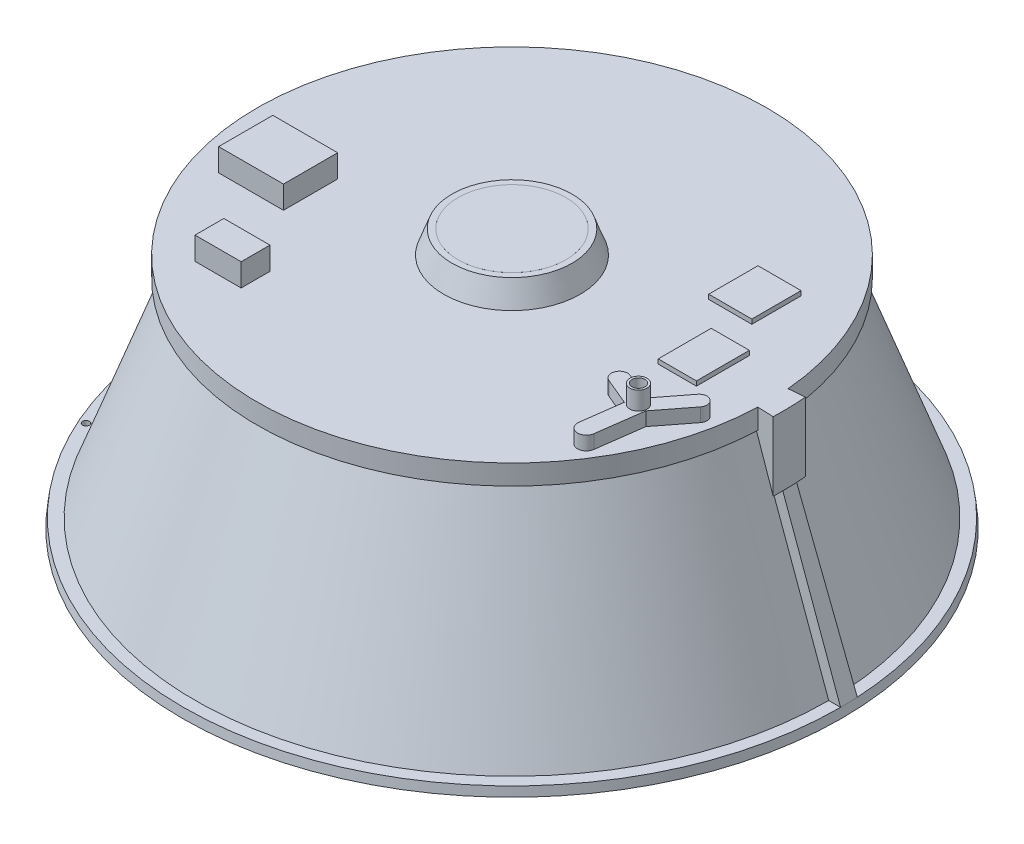
from build123d import *

# Parameters (mm, degrees)
REVOLVE_4_ANGLE           = 5
REVOLVE_4_OTHER_WAY_ANGLE = 2
CUT_EXTRUDE_1_DEPTH       = 1141.120605351
SKETCH_5_R                = 150
EXTRUDE_3_DEPTH           = 50
EXTRUDE_3_TAPER           = 20
SKETCH_9_W                = 101.343282943
SKETCH_9_H                = 63.282990441
SKETCH_9_W_2              = 142.463314855
SKETCH_9_H_2              = 119.061357177
EXTRUDE_5_DEPTH           = 50
SKETCH_9_3_W              = 101.343282943
SKETCH_9_3_H              = 63.282990441
SKETCH_9_3_W_2            = 142.463314855
SKETCH_9_3_H_2            = 119.061357177
SKETCH_9_3_W_3            = 94.707897755
SKETCH_9_3_H_3            = 108.237597434
SKETCH_9_3_W_4            = 83.884138011
SKETCH_9_3_H_4            = 116.355417242
EXTRUDE_6_DEPTH           = 10
EXTRUDE_10_DEPTH          = 30
SKETCH_11_R               = 18.870411167
EXTRUDE_11_DEPTH          = 40
CUT_EXTRUDE_2_DEPTH       = 40
CUT_EXTRUDE_2_DEPTH_BACK  = 1163.91658981
SKETCH_11_3_R             = 14.174126535


with BuildPart() as part:
    # 草图2 → 旋转2 (revolve)
    with BuildSketch(Plane.XY, mode=Mode.PRIVATE) as revolve_2_sk:
        Polygon((0, 520), (514.004150764, 520), (703.268672583, 0), (681.985117133, 0), (500, 500), (0, 500), align=None)
        Polygon((722.028861107, 20), (695.989267897, 20), (703.268672583, 0), (704.38769136, 0), (704.36800355, 0.156467804), (724.525705115, 0.156467804), align=None)
        with BuildLine():
            Line((560.03375626, 520), (514.004150764, 520))
            Line((514.004150764, 520), (522.853935072, 495.685417448))
            ThreePointArc((522.853935072, 495.685417448), (533.278359551, 508.108762772), (547.323148659, 500))
            Line((547.323148659, 500), (560.03375626, 520))
        make_face()
        Polygon((560.03375626, 475.959020857), (560.03375626, 520), (547.323148659, 500), (556.07334947, 475.959020857), align=None)
        with BuildLine():
            ThreePointArc((547.323148659, 500), (533.278359551, 508.108762772), (522.853935072, 495.685417448))
            Line((522.853935072, 495.685417448), (530.03375626, 475.959020857))
            Line((530.03375626, 475.959020857), (556.07334947, 475.959020857))
            Line((556.07334947, 475.959020857), (547.323148659, 500))
        make_face()
    revolve(revolve_2_sk.sketch.rotate(Axis((0, 0, 0), (0, 1, 0)), 90), axis=Axis((0, 0, 0), (0, 1, 0)))

    # 旋转3: read off the stored shape, not the designer's step
    # 旋转3: loft between two sections, ruled curve by curve
    revolve_3_from = [
        Edge.make_three_point_arc((555.311270271, 475.959020857, -29.102630486), (555.882797021, 475.959020857, -14.556303324), (556.07334947, 475.959020857, 0)),
        Edge.make_line((529.307363418, 475.959020857, -27.739823475), (555.311270271, 475.959020857, -29.102630486)),
        Edge.make_line((556.07334947, 475.959020857, 0), (530.03375626, 475.959020857, 0)),
        Edge.make_line((530.03375626, 475.959020857, 0), (529.307363418, 475.959020857, -27.739823475)),
    ]
    revolve_3_to = [
        Edge.make_three_point_arc((721.039345647, 20, -37.788070881), (721.78143985, 20, -18.900512174), (722.028861107, 20, 0)),
        Edge.make_line((695.035438794, 20, -36.42526387), (721.039345647, 20, -37.788070881)),
        Edge.make_line((722.028861107, 20, 0), (695.989267897, 20, 0)),
        Edge.make_line((695.989267897, 20, 0), (695.035438794, 20, -36.42526387)),
    ]
    revolve_3 = Solid(Shell([*[Face.make_surface_from_curves(revolve_3_from[k], revolve_3_to[k]) for k in range(4)], Face(Wire(revolve_3_from)), Face(Wire(revolve_3_to))]))
    add(revolve_3)

    # 草图2<11> → 旋转4 (revolve)
    with BuildSketch(Plane.XY):
        Polygon((595.137670099, 520), (560.03375626, 520), (560.03375626, 475.959020857), (556.07334947, 475.959020857), (595.137670099, 368.630682023), align=None)
    revolve(axis=Axis((0, 0, 0), (0, 1, 0)), revolution_arc=REVOLVE_4_ANGLE)

    # 草图2<11> → 旋转4 other way (revolve)
    with BuildSketch(Plane.XY):
        Polygon((595.137670099, 520), (560.03375626, 520), (560.03375626, 475.959020857), (556.07334947, 475.959020857), (595.137670099, 368.630682023), align=None)
    revolve(axis=Axis((0, 0, 0), (0, -1, 0)), revolution_arc=REVOLVE_4_OTHER_WAY_ANGLE)

    # 草图3 → 切除-拉伸1 (cut, through all)
    with BuildSketch(Plane(origin=(0, 20, 0), x_dir=(1, 0, 0), z_dir=(0, 1, 0))):
        with BuildLine():
            ThreePointArc((-649.025028468, -280.995795674), (-655.096181435, -289.69298497), (-646.398992139, -295.764137937))
            Line((-646.398992139, -295.764137937), (-649.025028468, -280.995795674))
        make_face()
        with BuildLine():
            Line((-649.025028468, -280.995795674), (-646.398992139, -295.764137937))
            ThreePointArc((-646.398992139, -295.764137937), (-641.963200156, -293.196727323), (-640.212010303, -288.379966806))
            ThreePointArc((-640.212010303, -288.379966806), (-642.895249786, -282.631156658), (-649.025028468, -280.995795674))
        make_face()
    extrude(amount=-CUT_EXTRUDE_1_DEPTH, mode=Mode.SUBTRACT)

    # 草图5 → 凸台-拉伸3 (add)
    with BuildSketch(Plane(origin=(0, 520, 0), x_dir=(1, 0, 0), z_dir=(0, 1, 0))):
        Circle(SKETCH_5_R)
    extrude(amount=EXTRUDE_3_DEPTH, taper=EXTRUDE_3_TAPER)

    # 切除-旋转4: read off the stored shape, not the designer's step
    # 切除-旋转4 outline → 切除-旋转4 (revolve, cut)
    with BuildSketch(Plane.XY):
        with BuildLine():
            Line((0, 570.0000001), (0, 541.754654672))
            ThreePointArc((0, 541.754654672), (60.887636923, 548.913608554), (118.45428562, 570.0000001))
            Line((118.45428562, 570.0000001), (0, 570.0000001))
        make_face()
    revolve(axis=Axis((0, 0, 0), (0, 1, 0)), mode=Mode.SUBTRACT)

    # 草图9 → 凸台-拉伸5 (add)
    with BuildSketch(Plane(origin=(0, 520, 0), x_dir=(1, 0, 0), z_dir=(0, 1, 0))):
        with Locations((-285.388042794, -328.86758542)):
            Rectangle(SKETCH_9_W, SKETCH_9_H)
        with Locations((-407.291341693, -106.628821994)):
            Rectangle(SKETCH_9_W_2, SKETCH_9_H_2)
    extrude(amount=EXTRUDE_5_DEPTH)

    # 草图9<3> → 凸台-拉伸6 (add)
    with BuildSketch(Plane(origin=(0, 520, 0), x_dir=(1, 0, 0), z_dir=(0, 1, 0))):
        with Locations((-285.388042794, -328.86758542)):
            Rectangle(SKETCH_9_3_W, SKETCH_9_3_H)
        with Locations((-407.291341693, -106.628821994)):
            Rectangle(SKETCH_9_3_W_2, SKETCH_9_3_H_2)
        with Locations((348.141651282, 185.612691078)):
            Rectangle(SKETCH_9_3_W_3, SKETCH_9_3_H_3)
        with Locations((410.378269806, 11.079565216)):
            Rectangle(SKETCH_9_3_W_4, SKETCH_9_3_H_4)
    extrude(amount=EXTRUDE_6_DEPTH)

    # 草图10 → 凸台-拉伸10 (add)
    with BuildSketch(Plane(origin=(0, 520, 0), x_dir=(1, 0, 0), z_dir=(0, 1, 0))):
        with BuildLine():
            Line((499.188166712, -90.979819427), (449.714835378, -154.845392603))
            Line((449.714835378, -154.845392603), (388.90299653, -129.286793666))
            ThreePointArc((388.90299653, -129.286793666), (365.492203191, -138.842219519), (375.047629043, -162.253012857))
            Line((375.047629043, -162.253012857), (433.806642006, -186.9488299))
            Line((433.806642006, -186.9488299), (421.883436355, -274.997117784))
            ThreePointArc((421.883436355, -274.997117784), (438.437846493, -296.73724676), (460.17797547, -280.182836622))
            Line((460.17797547, -280.182836622), (473.775090623, -179.773370873))
            Line((473.775090623, -179.773370873), (526.29348556, -111.976897408))
            ThreePointArc((526.29348556, -111.976897408), (523.239365127, -87.925698993), (499.188166712, -90.979819427))
        make_face()
    extrude(amount=EXTRUDE_10_DEPTH)

    # 草图11 → 凸台-拉伸11 (add)
    with BuildSketch(Plane(origin=(0, 550, 0), x_dir=(1, 0, 0), z_dir=(0, 1, 0))):
        with Locations(Location((452.935034731, -175.023325275, 0), (0, 0, 270))):
            Circle(SKETCH_11_R)
    extrude(amount=EXTRUDE_11_DEPTH)

    # 草图11<3> → 切除-拉伸2 (cut, two sides: drawn at the far end of the back side and taken through both)
    with BuildSketch(Plane(origin=(0, 550, 0), x_dir=(1, 0, 0), z_dir=(0, 1, 0)).offset(-CUT_EXTRUDE_2_DEPTH_BACK)):
        with Locations(Location((452.935034731, -175.023325275, 0), (0, 0, 270))):
            Circle(SKETCH_11_3_R)
    extrude(amount=CUT_EXTRUDE_2_DEPTH + CUT_EXTRUDE_2_DEPTH_BACK, mode=Mode.SUBTRACT)


with BuildPart() as body_2:
    # Cut-Revolve 4 2 outline → Cut-Revolve 4 2 (revolve)
    with BuildSketch(Plane.XY):
        Polygon((118.454285423, 570), (0, 570), (0, 569.697196729), align=None)
    revolve(axis=Axis((0, 0, 0), (0, 1, 0)))


solid = Compound([part.part, body_2.part])
